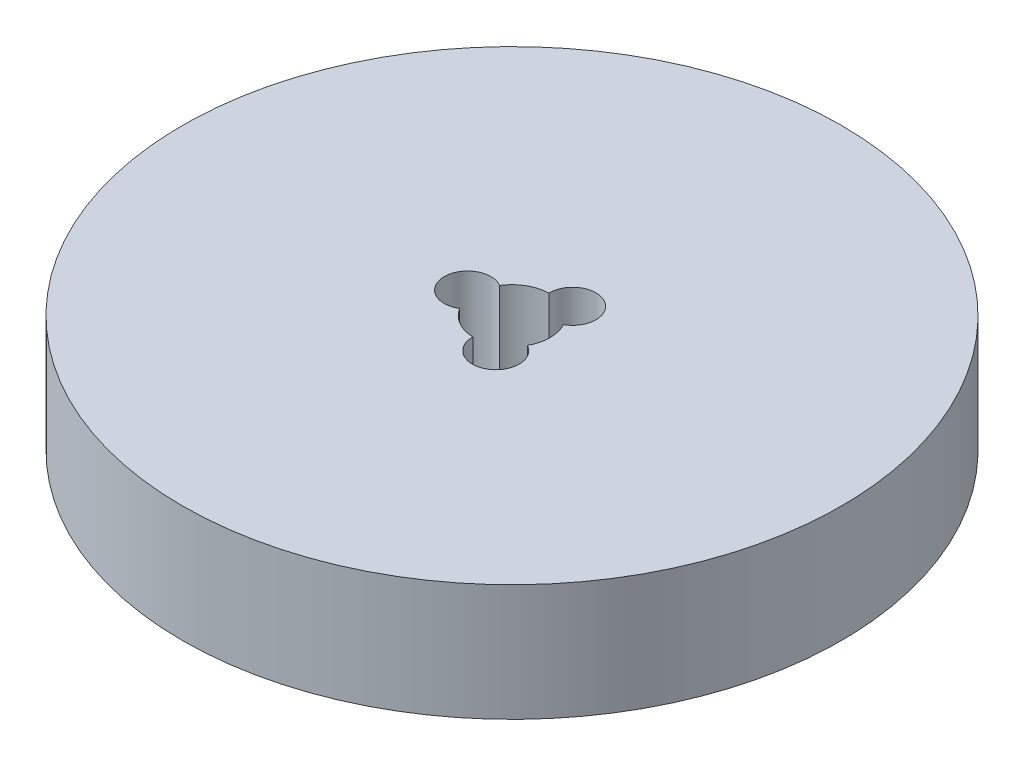
from build123d import *

# Parameters (mm, degrees)
SKETCH1_R           = 65
BOSS_EXTRUDE1_DEPTH = 23
SKETCH2_R           = 7.5
CUT_EXTRUDE1_DEPTH  = 95.757585448
SKETCH3_R           = 4.606516016
CUT_EXTRUDE2_DEPTH  = 17.603928813
CIRPATTERN1_COUNT   = 3


with BuildPart() as part:
    # Sketch1 → Boss-Extrude1 (new body)
    with BuildSketch(Plane(origin=(0, 0, 0), x_dir=(1, 0, 0), z_dir=(0, 1, 0))):
        Circle(SKETCH1_R)
    extrude(amount=BOSS_EXTRUDE1_DEPTH)

    # Sketch2 → Cut-Extrude1 (cut, through all)
    with BuildSketch(Plane(origin=(0, 0, 0), x_dir=(1, 0, 0), z_dir=(0, 1, 0))):
        Circle(SKETCH2_R)
    extrude(amount=CUT_EXTRUDE1_DEPTH, mode=Mode.SUBTRACT)

    # Sketch3 → Cut-Extrude2 (cut)
    with BuildSketch(Plane(origin=(0, 23, 0), x_dir=(1, 0, 0), z_dir=(0, 1, 0))):
        with Locations((-8.757154678, 0)):
            Circle(SKETCH3_R)
    cut_extrude2 = extrude(amount=-CUT_EXTRUDE2_DEPTH, mode=Mode.SUBTRACT)

    # CirPattern1: Cut-Extrude2 ×3 about axis
    cirpattern1_axis = Axis((0, 0, 0), (0, 1, 0))
    for i in range(1, CIRPATTERN1_COUNT):
        add(cut_extrude2.rotate(cirpattern1_axis, i * 360 / CIRPATTERN1_COUNT), mode=Mode.SUBTRACT)


solid = part.part
